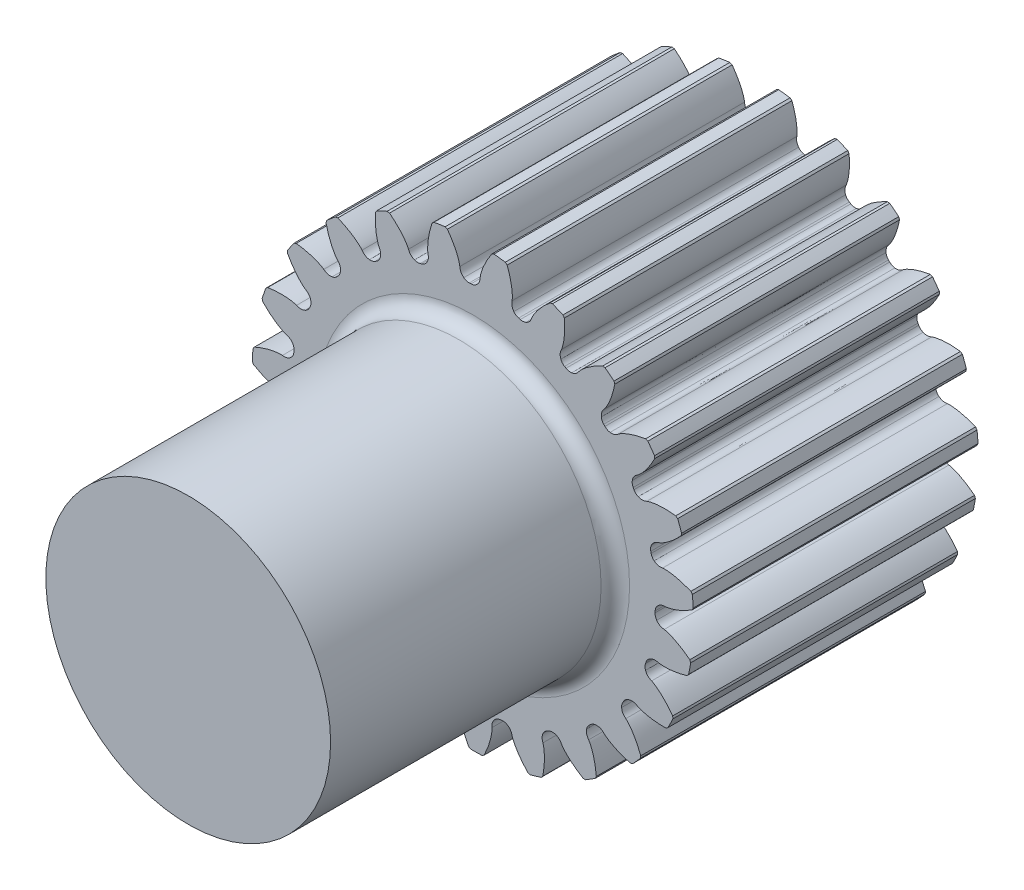
from build123d import *

# Parameters (mm, degrees)
SKETCH1_R           = 25.625
BOSS_EXTRUDE1_DEPTH = 40
BOSS_EXTRUDE2_DEPTH = 40
CHAMFER1_START      = -1
CHAMFER1_DEPTH      = 42
CIRPATTERN1_COUNT   = 23
SKETCH3_R           = 20
BOSS_EXTRUDE3_DEPTH = 40
FILLET1_R           = 2


with BuildPart() as part:
    # Sketch1 → Boss-Extrude1 (new body)
    with BuildSketch(Plane.XY):
        Circle(SKETCH1_R)
    extrude(amount=BOSS_EXTRUDE1_DEPTH)

    # Sketch2 → Boss-Extrude2 (add)
    with BuildSketch(Plane.XY):
        with BuildLine():
            ThreePointArc((25.595373618, -1.231858089), (25.535106966, 2.144513285), (25.031386189, 5.483642079))
            ThreePointArc((25.031386189, 5.483642079), (25.186947881, 5.10290781), (25.461935115, 4.797064639))
            add(Edge.make_bspline(
                [(26.63777136, 4.506018074), (26.216933834, 4.444156817), (25.865860255, 4.479510167), (25.461935115, 4.797064639)],
                knots=[0, 0, 0, 0, 1, 1, 1, 1], degree=3))
            add(Edge.make_bspline(
                [(26.63777136, 4.506018074), (26.644885827, 4.507063869), (26.664881791, 4.509717446), (26.702845445, 4.513629291), (26.764994747, 4.518439665), (26.844459465, 4.522254725), (26.947447773, 4.524524411), (27.069090656, 4.523772271), (27.203061927, 4.51935335), (27.349079123, 4.510666734), (27.494945306, 4.49856898), (27.64059643, 4.483306468), (27.785792018, 4.465220955), (27.961753224, 4.439909057), (28.172836719, 4.40482491), (28.419584749, 4.356926955), (28.699381461, 4.294475724), (28.984340738, 4.222151192), (29.264527418, 4.143858061), (29.547232956, 4.056580825), (29.820482783, 3.966345482), (30.103743669, 3.864276777), (30.364933148, 3.765816133), (30.588260284, 3.674364976), (30.718614509, 3.6200028), (30.787594054, 3.590548111), (30.791559511, 3.588852584)],
                knots=[0, 0, 0, 0, 0, 0.005376749, 0.015083688, 0.02853182, 0.04661014, 0.064854849, 0.092110526, 0.119476176, 0.146842496, 0.174208854, 0.201574956, 0.228941013, 0.256307345, 0.307035032, 0.361767352, 0.416499661, 0.471231937, 0.525964282, 0.580696616, 0.635428982, 0.690161387, 0.744893688, 0.799626082, 0.802957873, 0.802957873, 0.802957873, 0.802957873, 0.802957873], degree=4))
            ThreePointArc((30.791559511, 3.588852584), (30.891251356, 2.594337997), (30.958830517, 1.597126493))
            add(Edge.make_bspline(
                [(27.01619999, 3.4e-08), (27.023389229, 0.000155506), (27.043547689, 0.000874215), (27.081632023, 0.003349103), (27.14371309, 0.00897196), (27.22270102, 0.018464218), (27.324625282, 0.03340369), (27.444438808, 0.054434047), (27.575796451, 0.081136069), (27.718319479, 0.114055138), (27.860124668, 0.150312377), (28.001189962, 0.189654175), (28.141335255, 0.231703451), (28.310609931, 0.286009271), (28.512885014, 0.355808483), (28.748187854, 0.444190483), (29.013649114, 0.552434078), (29.282553862, 0.671273734), (29.545757365, 0.795202366), (29.80994599, 0.928409377), (30.064317973, 1.062955947), (30.326587105, 1.210839862), (30.567695781, 1.351484977), (30.772641575, 1.478903748), (30.892102826, 1.554246159), (30.955203406, 1.594793321), (30.958830517, 1.597126493)],
                knots=[0, 0, 0, 0, 0, 0.005376749, 0.015083688, 0.02853182, 0.04661014, 0.064854849, 0.092110526, 0.119476176, 0.146842496, 0.174208854, 0.201574956, 0.228941013, 0.256307345, 0.307035032, 0.361767352, 0.416499661, 0.471231937, 0.525964282, 0.580696616, 0.635428982, 0.690161387, 0.744893688, 0.799626082, 0.80295787, 0.80295787, 0.80295787, 0.80295787, 0.80295787], degree=4))
            add(Edge.make_bspline(
                [(27.01619999, 3.4e-08), (26.590939526, -0.009196504), (26.250680167, -0.102610025), (25.905377744, -0.483086828)],
                knots=[0, 0, 0, 0, 1, 1, 1, 1], degree=3))
            ThreePointArc((25.905377744, -0.483086828), (25.685253811, -0.830510889), (25.595373618, -1.231858089))
        make_face()
    boss_extrude2 = extrude(amount=BOSS_EXTRUDE2_DEPTH)

    # Chamfer1: read off the stored shape, not the designer's step
    # Chamfer1 outline → Chamfer1 (cut)
    with BuildSketch(Plane.XY.offset(CHAMFER1_START)):
        with BuildLine():
            ThreePointArc((30.958830517, 1.597126493), (30.953547514, 1.696436352), (30.947945946, 1.795728752))
            Line((30.947945946, 1.795728752), (30.791874927, 1.491363593))
            add(Edge.make_bspline(
                [(30.791874927, 1.491363593), (30.831065309, 1.515873974), (30.872983382, 1.542276123), (30.91374688, 1.568154192), (30.955203406, 1.594793321), (30.958830517, 1.597126493)],
                knots=[0.764810213, 0.764810213, 0.764810213, 0.764810213, 0.764810213, 0.799626082, 0.80295787, 0.80295787, 0.80295787, 0.80295787, 0.80295787], degree=4))
        make_face()
        with BuildLine():
            Line((30.609302408, 3.665287578), (30.813952173, 3.391216808))
            ThreePointArc((30.813952173, 3.391216808), (30.80291435, 3.490052655), (30.791559511, 3.588852584))
            add(Edge.make_bspline(
                [(30.791559511, 3.588852584), (30.787594054, 3.590548111), (30.742275103, 3.609899581), (30.697766409, 3.628616242), (30.652031901, 3.647657071), (30.609302408, 3.665287578)],
                knots=[0, 0, 0, 0, 0, 0.003331791, 0.038147657, 0.038147657, 0.038147657, 0.038147657, 0.038147657], degree=4))
        make_face()
    chamfer1 = extrude(amount=CHAMFER1_DEPTH, mode=Mode.SUBTRACT)

    # CirPattern1: Boss-Extrude2, Chamfer1 ×23 about axis
    cirpattern1_axis = Axis((0, 0, 40), (0, 0, -1))
    add([boss_extrude2.rotate(cirpattern1_axis, i * 360 / CIRPATTERN1_COUNT) for i in range(1, CIRPATTERN1_COUNT)])
    add([chamfer1.rotate(cirpattern1_axis, i * 360 / CIRPATTERN1_COUNT) for i in range(1, CIRPATTERN1_COUNT)], mode=Mode.SUBTRACT)

    # Sketch3 → Boss-Extrude3 (add)
    with BuildSketch(Plane.XY.offset(40)):
        Circle(SKETCH3_R)
    extrude(amount=BOSS_EXTRUDE3_DEPTH)

    # Fillet1
    fillet1_edges = [part.edges().sort_by_distance(p)[0] for p in [
        (-20, 0, 40),
    ]]
    fillet(fillet1_edges, radius=FILLET1_R)


solid = part.part
